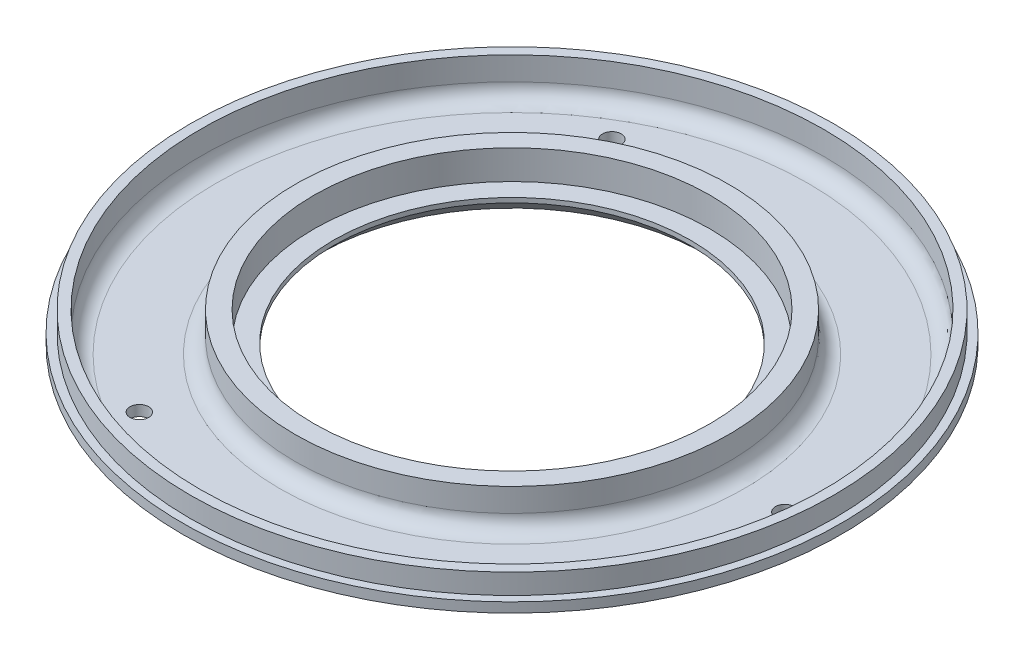
from build123d import *

# Parameters (mm, degrees)
F_90_0_0087_DIAMETER_HOLE1_D = 0.22098
CIRPATTERN3_COUNT            = 3
SKETCH8_R                    = 80.01
SKETCH8_R_2                  = 55.626
CUT_EXTRUDE1_DEPTH           = 10
FILLET5_R                    = 4
CHAMFER1_SIZE                = 4
BOSS_EXTRUDE1_START          = -7.5
SKETCH10_R                   = 84.55
SKETCH10_R_2                 = 82.55
BOSS_EXTRUDE1_DEPTH          = 7.5
CHAMFER3_SIZE                = 5
CHAMFER3_SIZE2               = 8.660254038
FILLET4_R                    = 5
F_12_0_189_DIAMETER_HOLE1_D  = 4.8006
CIRPATTERN5_COUNT            = 3


with BuildPart() as part:
    # Sketch2 → Revolve1 (revolve)
    with BuildSketch(Plane(origin=(0, 0, 0), x_dir=(0, 0, -1), z_dir=(1, 0, 0))):
        Polygon((-45.8, 0), (-82.55, 0), (-82.55, 12.7), (-50.8, 12.7), (-50.8, 5.2), (-45.8, 5.2), align=None)
    revolve(axis=Axis((0, -0.635, 0), (0, 1, 0)))

    # #90 (0.0087) Diameter Hole1 (through all)
    with Locations(Plane(origin=(0, 12.7, 0), x_dir=(1, 0, 0), z_dir=(0, 1, 0))):
        with Locations((-35, 60.621778265)):
            f_90_0_0087_diameter_hole1 = Hole(F_90_0_0087_DIAMETER_HOLE1_D / 2)

    # CirPattern3: #90 (0.0087) Diameter Hole1 ×3 about axis
    cirpattern3_axis = Axis((0, -0.635, 0), (0, 1, 0))
    for i in range(1, CIRPATTERN3_COUNT):
        add(f_90_0_0087_diameter_hole1.rotate(cirpattern3_axis, i * 360 / CIRPATTERN3_COUNT), mode=Mode.SUBTRACT)

    # Sketch8 → Cut-Extrude1 (cut)
    with BuildSketch(Plane(origin=(0, 12.7, 0), x_dir=(1, 0, 0), z_dir=(0, 1, 0))):
        Circle(SKETCH8_R)
        Circle(SKETCH8_R_2, mode=Mode.SUBTRACT)
    extrude(amount=-CUT_EXTRUDE1_DEPTH, mode=Mode.SUBTRACT)

    # Fillet5
    fillet5_edges = [part.edges().sort_by_distance(p)[0] for p in [
        (-55.626, 2.7, 0),
        (-80.01, 2.7, 0),
    ]]
    fillet(fillet5_edges, radius=FILLET5_R)

    # Chamfer1
    chamfer1_edges = [part.edges().sort_by_distance(p)[0] for p in [
        (0, 0, -45.8),
    ]]
    chamfer(chamfer1_edges, length=CHAMFER1_SIZE)

    # Sketch10 → Boss-Extrude1 (add)
    with BuildSketch(Plane.XZ.offset(BOSS_EXTRUDE1_START)):
        Circle(SKETCH10_R)
        Circle(SKETCH10_R_2, mode=Mode.SUBTRACT)
    extrude(amount=BOSS_EXTRUDE1_DEPTH)

    # Chamfer3
    chamfer3_edges = [part.edges().sort_by_distance(p)[0] for p in [
        (-84.55, 0, 0),
    ]]
    chamfer3_side = [part.faces().sort_by_distance(p)[0] for p in [
        (-84.55, 3.75, 0),
    ]]
    chamfer(chamfer3_edges, length=CHAMFER3_SIZE, length2=CHAMFER3_SIZE2, reference=chamfer3_side[0])

    # Fillet4
    fillet4_edges = [part.edges().sort_by_distance(p)[0] for p in [
        (-75.889745962, 0, 0),
    ]]
    fillet(fillet4_edges, radius=FILLET4_R)

    # #12 (0.189) Diameter Hole1 (through all)
    with Locations(Plane(origin=(0, 0, 0), x_dir=(-1, 0, 0), z_dir=(0, -1, 0))):
        with Locations((35, 60.621778265)):
            f_12_0_189_diameter_hole1 = Hole(F_12_0_189_DIAMETER_HOLE1_D / 2)

    # CirPattern5: #12 (0.189) Diameter Hole1 ×3 about axis
    cirpattern5_axis = Axis((0, -0.635, 0), (0, 1, 0))
    for i in range(1, CIRPATTERN5_COUNT):
        add(f_12_0_189_diameter_hole1.rotate(cirpattern5_axis, i * 360 / CIRPATTERN5_COUNT), mode=Mode.SUBTRACT)


solid = part.part
